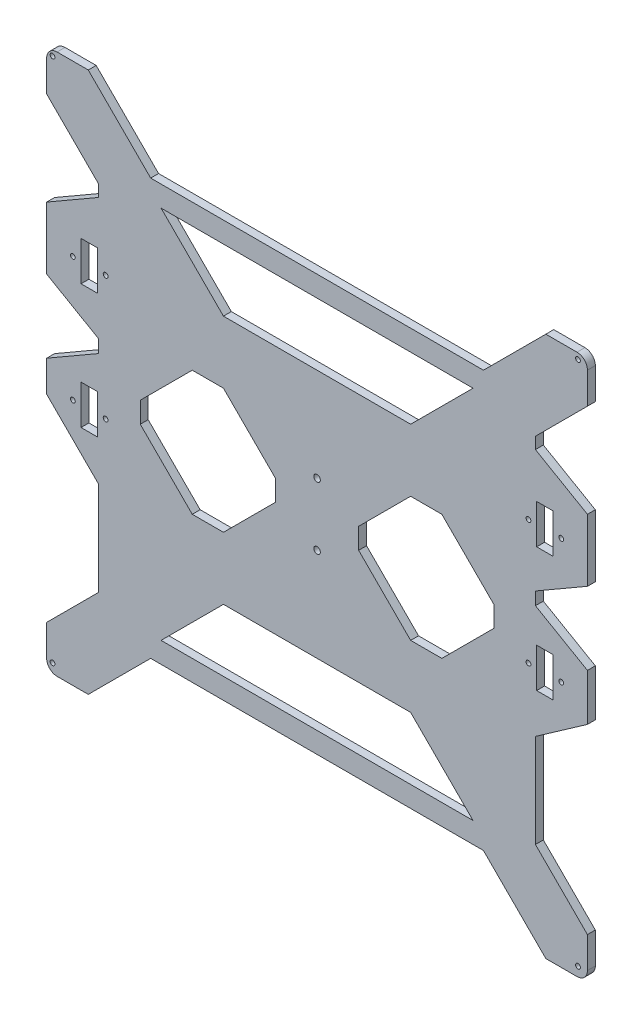
from build123d import *

# Parameters (mm, degrees)
MODEL_R             = 1.4605
MODEL_R_2           = 2
BOSS_EXTRUDE1_DEPTH = 2.413
SKETCH1_W           = 10
SKETCH1_H           = 24
CUT_EXTRUDE1_DEPTH  = 10


with BuildPart() as part:
    # Model → Boss-Extrude1 (new, symmetric)
    with BuildSketch(Plane.XY):
        with BuildLine():
            Line((-258.931304326, -12.937428953), (-290.681304326, -31.2683))
            Line((-290.681304326, -31.2683), (-290.681304326, -50.3183))
            Line((-290.681304326, -50.3183), (-258.931304326, -82.0683))
            Line((-258.931304326, -82.0683), (-258.931304326, -139.2183))
            Line((-258.931304326, -139.2183), (-290.681304326, -170.9683))
            Line((-290.681304326, -170.9683), (-290.681304326, -190.0183))
            ThreePointArc((-290.681304326, -190.0183), (-288.821432386, -194.508428061), (-284.331304326, -196.3683))
            Line((-284.331304326, -196.3683), (-265.281304326, -196.3683))
            Line((-265.281304326, -196.3683), (-227.181304326, -158.2683))
            Line((-227.181304326, -158.2683), (-23.981304326, -158.2683))
            Line((-23.981304326, -158.2683), (14.118695674, -196.3683))
            Line((14.118695674, -196.3683), (33.168695674, -196.3683))
            ThreePointArc((33.168695674, -196.3683), (37.658823735, -194.508428061), (39.518695674, -190.0183))
            Line((39.518695674, -190.0183), (39.518695674, -170.9683))
            Line((39.518695674, -170.9683), (7.768695674, -139.2183))
            Line((7.768695674, -139.2183), (7.768695674, -82.0683))
            Line((7.768695674, -82.0683), (10.464640386, -80.18057919))
            Line((10.464640386, -80.18057919), (39.518695674, -59.836710662))
            Line((39.518695674, -59.836710662), (39.518695674, -31.2683))
            Line((39.518695674, -31.2683), (7.768695674, -12.937428953))
            Line((7.768695674, -12.937428953), (7.768695674, -5.149171047))
            Line((7.768695674, -5.149171047), (39.518695674, 13.1817))
            Line((39.518695674, 13.1817), (39.518695674, 51.2817))
            Line((39.518695674, 51.2817), (7.768695674, 69.612571047))
            Line((7.768695674, 69.612571047), (7.768695674, 76.6817))
            Line((7.768695674, 76.6817), (39.518695674, 108.4317))
            Line((39.518695674, 108.4317), (39.518695674, 127.4817))
            ThreePointArc((39.518695674, 127.4817), (37.658823735, 131.971828061), (33.168695674, 133.8317))
            Line((33.168695674, 133.8317), (14.118695674, 133.8317))
            Line((14.118695674, 133.8317), (-23.981304326, 95.7317))
            Line((-23.981304326, 95.7317), (-227.181304326, 95.7317))
            Line((-227.181304326, 95.7317), (-265.281304326, 133.8317))
            Line((-265.281304326, 133.8317), (-284.331304326, 133.8317))
            ThreePointArc((-284.331304326, 133.8317), (-288.821432386, 131.971828061), (-290.681304326, 127.4817))
            Line((-290.681304326, 127.4817), (-290.681304326, 108.4317))
            Line((-290.681304326, 108.4317), (-258.931304326, 76.6817))
            Line((-258.931304326, 76.6817), (-258.931304326, 69.612571047))
            Line((-258.931304326, 69.612571047), (-290.681304326, 51.2817))
            Line((-290.681304326, 51.2817), (-290.681304326, 13.1817))
            Line((-290.681304326, 13.1817), (-258.931304326, -5.149171047))
            Line((-258.931304326, -5.149171047), (-258.931304326, -12.937428953))
        make_face()
        with Locations((-287.125304326, -190.6025)):
            Circle(MODEL_R, mode=Mode.SUBTRACT)
        Polygon((-68.431304326, -107.4683), (-30.331304326, -145.5683), (-220.831304326, -145.5683), (-182.731304326, -107.4683), align=None, mode=Mode.SUBTRACT)
        with Locations((-274.681304256, -45.4288)):
            Circle(MODEL_R, mode=Mode.SUBTRACT)
        with Locations((-254.681304256, -45.4288)):
            Circle(MODEL_R, mode=Mode.SUBTRACT)
        with Locations((-125.581304326, -50.3183)):
            Circle(MODEL_R_2, mode=Mode.SUBTRACT)
        with Locations((33.752895674, -190.6025)):
            Circle(MODEL_R, mode=Mode.SUBTRACT)
        with Locations((3.518695604, -45.4288)):
            Circle(MODEL_R, mode=Mode.SUBTRACT)
        with Locations((23.518695604, -45.4288)):
            Circle(MODEL_R, mode=Mode.SUBTRACT)
        with Locations((-274.681304256, 30.5682)):
            Circle(MODEL_R, mode=Mode.SUBTRACT)
        with Locations((-254.681304256, 30.5682)):
            Circle(MODEL_R, mode=Mode.SUBTRACT)
        Polygon((-182.731304326, -69.3683), (-201.781304326, -69.3683), (-233.531304326, -37.6183), (-233.531304326, -24.9183), (-201.781304326, 6.8317), (-182.731304326, 6.8317), (-150.981304326, -24.9183), (-150.981304326, -37.6183), align=None, mode=Mode.SUBTRACT)
        with Locations((-125.581304326, -12.2183)):
            Circle(MODEL_R_2, mode=Mode.SUBTRACT)
        with Locations((-287.125304326, 130.2757)):
            Circle(MODEL_R, mode=Mode.SUBTRACT)
        Polygon((-182.731304326, 44.9317), (-220.831304326, 83.0317), (-30.331304326, 83.0317), (-68.431304326, 44.9317), align=None, mode=Mode.SUBTRACT)
        Polygon((-68.431304326, -69.3683), (-100.181304326, -37.6183), (-100.181304326, -24.9183), (-68.431304326, 6.8317), (-49.381304326, 6.8317), (-17.631304326, -24.9183), (-17.631304326, -37.6183), (-49.381304326, -69.3683), align=None, mode=Mode.SUBTRACT)
        with Locations((3.518695604, 30.5682)):
            Circle(MODEL_R, mode=Mode.SUBTRACT)
        with Locations((23.518695604, 30.5682)):
            Circle(MODEL_R, mode=Mode.SUBTRACT)
        with Locations((33.752895674, 130.2757)):
            Circle(MODEL_R, mode=Mode.SUBTRACT)
    extrude(amount=BOSS_EXTRUDE1_DEPTH, both=True)

    # Sketch1 → Cut-Extrude1 (cut)
    with BuildSketch(Plane.XY.offset(2.413)):
        with Locations((-264.681304256, -45.4288)):
            Rectangle(SKETCH1_W, SKETCH1_H)
        with Locations((-264.681304256, 30.5712)):
            Rectangle(SKETCH1_W, SKETCH1_H)
        with Locations((13.518695604, 30.5712)):
            Rectangle(SKETCH1_W, SKETCH1_H)
        with Locations((13.518695604, -45.4288)):
            Rectangle(SKETCH1_W, SKETCH1_H)
    extrude(amount=-CUT_EXTRUDE1_DEPTH, mode=Mode.SUBTRACT)


solid = part.part
